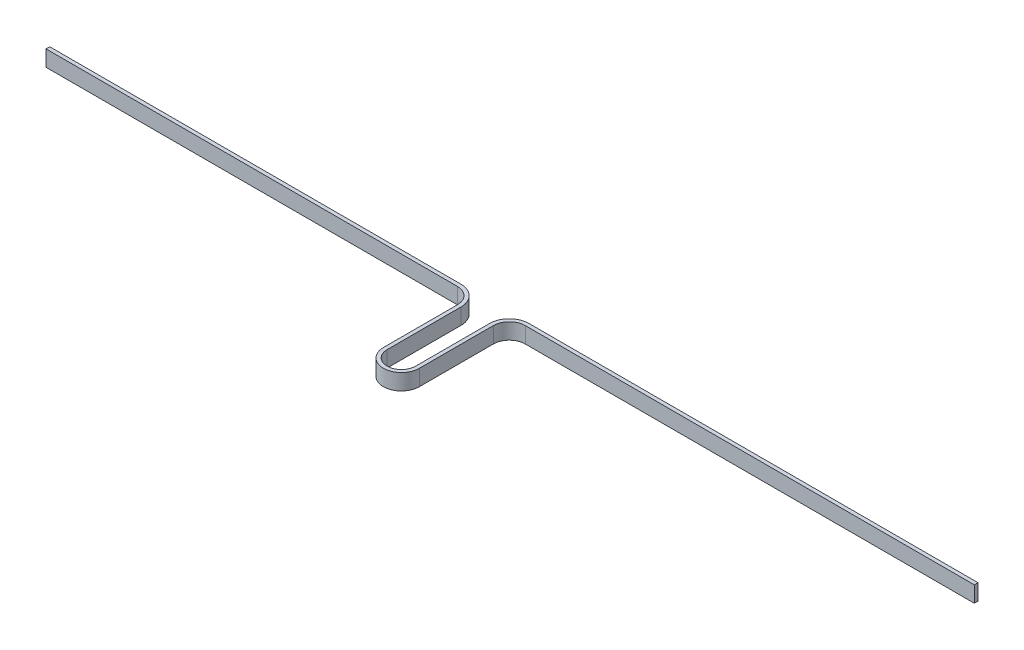
from build123d import *

# Parameters (mm, degrees)
EXTRUDE_THIN1_DEPTH = 6


with BuildPart() as part:
    # Sketch1 → Extrude-Thin1 (new body)
    with BuildSketch(Plane(origin=(0, 0, 0), x_dir=(1, 0, 0), z_dir=(0, 1, 0))):
        with BuildLine():
            Line((531.62539661, -259.643481844), (363.12, -259.643481844))
            ThreePointArc((363.12, -259.643481844), (357.905794596, -261.80327644), (355.746, -267.017481844))
            Line((355.746, -267.017481844), (355.746, -294.767481844))
            ThreePointArc((355.746, -294.767481844), (350.38, -300.133481844), (345.014, -294.767481844))
            Line((345.014, -294.767481844), (345.014, -267.017481844))
            ThreePointArc((345.014, -267.017481844), (342.854205404, -261.80327644), (337.64, -259.643481844))
            Line((337.64, -259.643481844), (183.275, -259.643481844))
            Line((183.275, -259.643481844), (183.275, -261.023481844))
            Line((183.275, -261.023481844), (337.64, -261.023481844))
            ThreePointArc((337.64, -261.023481844), (341.878398046, -262.779083798), (343.634, -267.017481844))
            Line((343.634, -267.017481844), (343.634, -294.767481844))
            ThreePointArc((343.634, -294.767481844), (350.38, -301.513481844), (357.126, -294.767481844))
            Line((357.126, -294.767481844), (357.126, -267.017481844))
            ThreePointArc((357.126, -267.017481844), (358.881601954, -262.779083798), (363.12, -261.023481844))
            Line((363.12, -261.023481844), (531.62539661, -261.023481844))
            Line((531.62539661, -261.023481844), (531.62539661, -259.643481844))
        make_face()
    extrude(amount=EXTRUDE_THIN1_DEPTH)


solid = part.part
